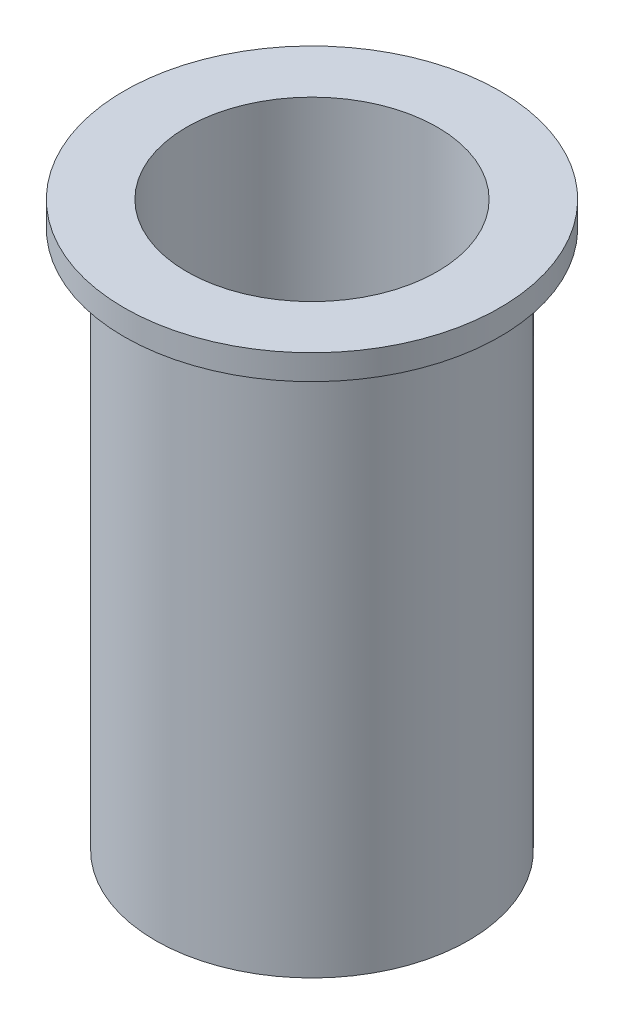
from build123d import *

# Parameters (mm, degrees)
SKETCH1_R           = 3
BOSS_EXTRUDE1_DEPTH = 0.4
SKETCH2_R           = 2.5
BOSS_EXTRUDE2_DEPTH = 8.6
SHELL1_START        = -8.5
SHELL1_OUTLINE_R    = 2
SHELL1_DEPTH        = 8.5
CUT_EXTRUDE1_REACH  = 11.95
SKETCH3_R           = 1.5


# Read off the part's stored shape, not the designer's step: Shell1
with BuildPart() as part:
    # Sketch1 → Boss-Extrude1 (new body)
    with BuildSketch(Plane(origin=(0, 0, 0), x_dir=(1, 0, 0), z_dir=(0, 1, 0))):
        with Locations(Location((0, 0, 0), (0, 0, 270))):
            Circle(SKETCH1_R)
    extrude(amount=-BOSS_EXTRUDE1_DEPTH)

    # Sketch2 → Boss-Extrude2 (add)
    with BuildSketch(Plane.XZ.offset(0.4)):
        with Locations(Location((0, 0, 0), (0, 0, 90))):
            Circle(SKETCH2_R)
    extrude(amount=BOSS_EXTRUDE2_DEPTH)

    # Shell1 outline → Shell1 (cut)
    with BuildSketch(Plane(origin=(0, 0, 0), x_dir=(1, 0, 0), z_dir=(0, 1, 0)).offset(SHELL1_START)):
        Circle(SHELL1_OUTLINE_R)
    extrude(amount=SHELL1_DEPTH, mode=Mode.SUBTRACT)

    # Sketch3 → Cut-Extrude1 (cut, up to next)
    with BuildSketch(Plane.XZ.offset(9), mode=Mode.PRIVATE) as cut_extrude1_sk1:
        with Locations(Location((0, 0, 0), (0, 0, 270))):
            Circle(SKETCH3_R)
    cut_extrude1_tool1 = extrude(cut_extrude1_sk1.sketch, amount=-CUT_EXTRUDE1_REACH, mode=Mode.PRIVATE) & part.part
    add(cut_extrude1_tool1.solids().sort_by_distance((0, -9, 0))[0], mode=Mode.SUBTRACT)


solid = part.part
